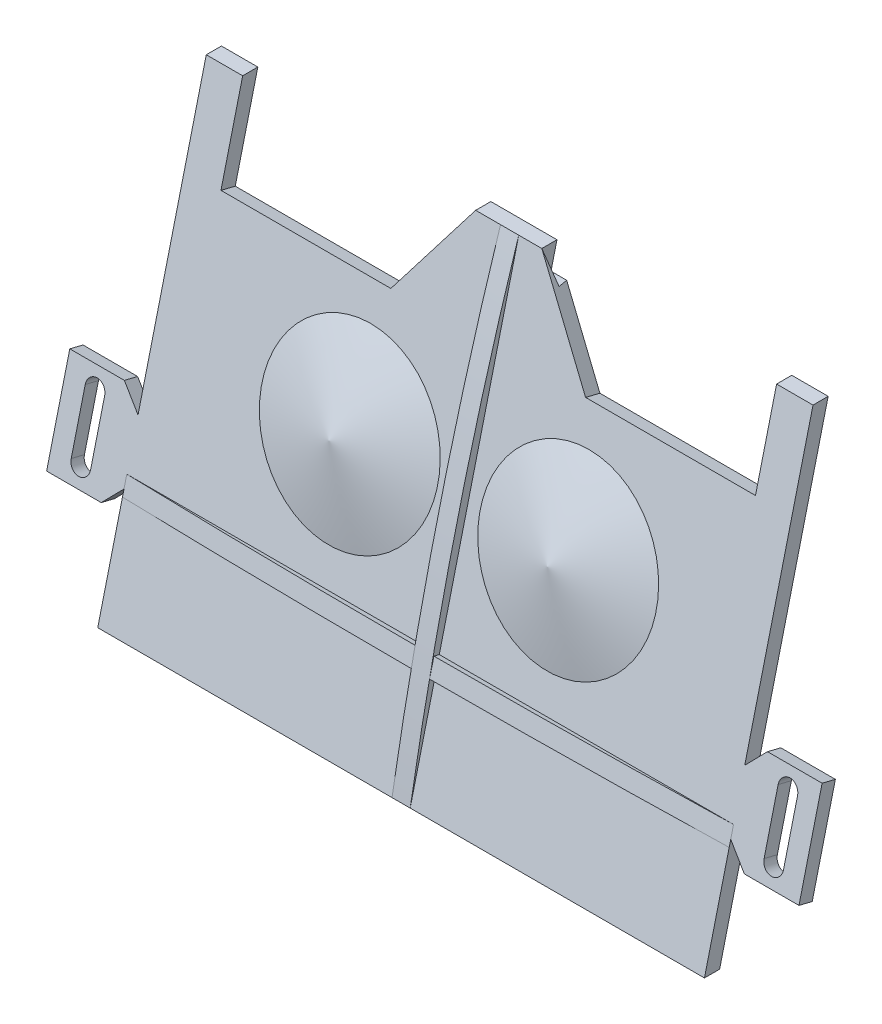
from build123d import *

# Parameters (mm, degrees)
SALIENTE_EXTRUIR1_DEPTH  = 100
CROQUIS7_R               = 13.5
CORTAR_EXTRUIR3_DEPTH    = 10
CORTAR_EXTRUIR15_DEPTH   = 10
CROQUIS21_W              = 38.401190139
CROQUIS21_H              = 2.5
CROQUIS21_W_2            = 38.697919604
CORTAR_EXTRUIR19_DEPTH   = 4
SALIENTE_EXTRUIR9_DEPTH  = 1.5
SALIENTE_EXTRUIR10_DEPTH = 1.5
SALIENTE_EXTRUIR11_DEPTH = 2.25


with BuildPart() as part:
    # Croquis1 → Saliente-Extruir1 (new body)
    with BuildSketch(Plane(origin=(0, 0, 0), x_dir=(0, 0, -1), z_dir=(1, 0, 0))):
        Polygon((0, 0), (2.5, 0), (20.390009318, 72.835070993), (17.890009318, 72.835070993), align=None)
    extrude(amount=-SALIENTE_EXTRUIR1_DEPTH)

    # Croquis7 → Cortar-Extruir3 (cut)
    with BuildSketch(Plane(origin=(0, 0, 0), x_dir=(1, 0, 0), z_dir=(0, 0.2385334575785814, 0.9711342799096359))):
        with Locations((-68, 40)):
            Circle(CROQUIS7_R)
        with Locations((-32.530981428, 40)):
            Circle(CROQUIS7_R)
    extrude(amount=-CORTAR_EXTRUIR3_DEPTH, mode=Mode.SUBTRACT)

    # Croquis11 → Cortar-Extruir15 (cut)
    with BuildSketch(Plane(origin=(0, 0, 0), x_dir=(1, 0, 0), z_dir=(0, 0.2385334575785814, 0.9711342799096359))):
        Polygon((-55.598809861, 75), (-94, 75), (-94, 60), (-66, 60), align=None)
        Polygon((-6, 75), (-44.697919604, 75), (-34, 60.408256125), (-6, 60.408256125), align=None)
    extrude(amount=-CORTAR_EXTRUIR15_DEPTH, mode=Mode.SUBTRACT)

    # Croquis13 → Revolución1 (revolve)
    with BuildSketch(Plane(origin=(-32, 0, 0), x_dir=(0, 0, -1), z_dir=(1, 0, 0))):
        with BuildLine():
            Line((6.082603168, 24.763924138), (6.559670083, 26.706192698))
            ThreePointArc((6.559670083, 26.706192698), (6.480065799, 33.134186134), (6.627935463, 39.560971569))
            Line((6.627935463, 39.560971569), (6.087472186, 39.693722083))
            ThreePointArc((6.087472186, 39.693722083), (5.932063338, 32.228872999), (6.082603168, 24.763924138))
        make_face()
    revoluci_n1 = revolve(axis=Axis((-32, 31.695739537, -38.649424286), (0, 0.23853345757858133, 0.971134279909636)))

    # Simetría1: Revolución1 across plane
    add(revoluci_n1.mirror(Plane(origin=(-50, 0, 0), x_dir=(0, 0, 1), z_dir=(1, 0, 0))))

    # Croquis21 → Cortar-Extruir19 (cut)
    with BuildSketch(Plane(origin=(0, 72.835070993, 0), x_dir=(1, 0, 0), z_dir=(0, 1, 0))):
        with Locations((-74.799404931, 19.140009318)):
            Rectangle(CROQUIS21_W, CROQUIS21_H)
        with Locations((-25.348959802, 19.140009318)):
            Rectangle(CROQUIS21_W_2, CROQUIS21_H)
    extrude(amount=-CORTAR_EXTRUIR19_DEPTH, mode=Mode.SUBTRACT)

    # Croquis33 → Saliente-Extruir9 (add, symmetric)
    with BuildSketch(Plane(origin=(0, 18.059537082, -4.435847762), x_dir=(1, 0, 0), z_dir=(0, 0.9711342799096361, -0.23853345757858138))):
        with BuildLine():
            Line((0, 0), (-100, 0))
            ThreePointArc((-100, 0), (-50, -0.911138334), (0, 0))
        make_face()
    extrude(amount=SALIENTE_EXTRUIR9_DEPTH, both=True)

    # Croquis35 → Saliente-Extruir10 (add, symmetric)
    with BuildSketch(Plane(origin=(-50, 0, 0), x_dir=(0, 0, -1), z_dir=(1, 0, 0))):
        with BuildLine():
            Line((0, 0), (17.890009318, 72.835070993))
            ThreePointArc((17.890009318, 72.835070993), (7.65037577, 36.735526851), (0, 0))
        make_face()
    extrude(amount=SALIENTE_EXTRUIR10_DEPTH, both=True)

    # Croquis36 → Saliente-Extruir11 (add)
    # profile 1 of 2: a face of its own
    with BuildSketch(Plane(origin=(0, 0, 0), x_dir=(1, 0, 0), z_dir=(0, 0.23853345757858144, 0.971134279909636))):
        Polygon((3, 31), (12, 31), (12, 15), (3, 15), (0, 18.155556941), (0, 27.844443059), align=None)
        with BuildLine():
            Line((8.7, 27.844443059), (8.7, 18.155556941))
            ThreePointArc((8.7, 18.155556941), (7.1, 16.555556941), (5.5, 18.155556941))
            Line((5.5, 18.155556941), (5.5, 27.844443059))
            ThreePointArc((5.5, 27.844443059), (7.1, 29.444443059), (8.7, 27.844443059))
        make_face(mode=Mode.SUBTRACT)
    # profile 2 of 2: a face of its own
    with BuildSketch(Plane(origin=(0, 0, 0), x_dir=(1, 0, 0), z_dir=(0, 0.23853345757858144, 0.971134279909636))):
        Polygon((-100, 18.155556941), (-103, 15), (-112, 15), (-112, 31), (-103, 31), (-100, 27.844443059), align=None)
        with BuildLine():
            Line((-108.7, 27.844443059), (-108.7, 18.155556941))
            ThreePointArc((-108.7, 18.155556941), (-107.1, 16.555556941), (-105.5, 18.155556941))
            Line((-105.5, 18.155556941), (-105.5, 27.844443059))
            ThreePointArc((-105.5, 27.844443059), (-107.1, 29.444443059), (-108.7, 27.844443059))
        make_face(mode=Mode.SUBTRACT)
    extrude(amount=-SALIENTE_EXTRUIR11_DEPTH)


solid = part.part
